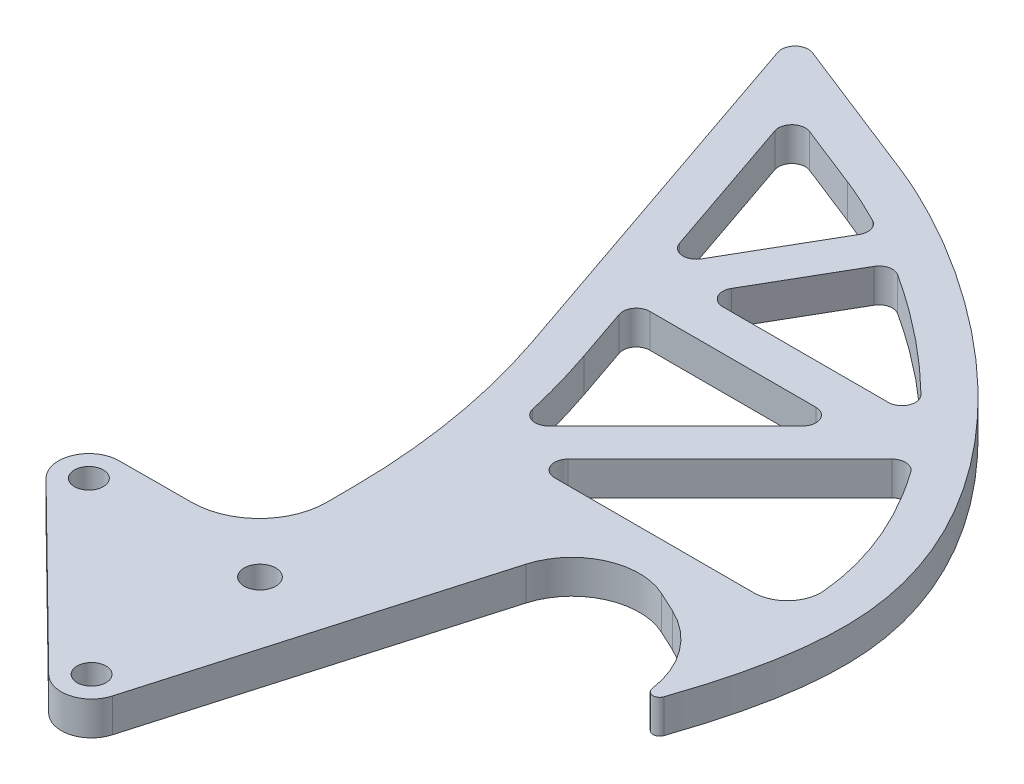
from build123d import *

# Parameters (mm, degrees)
SKETCH1_R           = 2.35
SKETCH1_R_2         = 2.15
BOSS_EXTRUDE1_DEPTH = 5
BOSS_EXTRUDE2_DEPTH = 5
FILLET9_START       = -1
FILLET9_DEPTH       = 7
FILLET10_R          = 10
FILLET11_R          = 10
FILLET12_R          = 2
FILLET13_R          = 100
CUT_EXTRUDE1_DEPTH  = 10
FILLET16_R          = 2
FILLET17_R          = 5


with BuildPart() as part:
    # Sketch1 → Boss-Extrude1 (new body)
    # profile 1 of 5: a face of its own
    with BuildSketch(Plane(origin=(0, 0, 0), x_dir=(1, 0, 0), z_dir=(0, 1, 0))):
        with BuildLine():
            Line((21.319657121, 32.633890732), (34.914273926, 26.294616806))
            ThreePointArc((34.914273926, 26.294616806), (41.225871687, 20.759494125), (43.575, 12.7))
            ThreePointArc((43.575, 12.7), (43.275555611, 9.717775204), (42.389178035, 6.854618472))
            add(Edge.make_bspline(
                [(42.389178035, 6.854618472), (44.342966782, 11.471936513), (48.441890724, 22.813367807), (54.26521217, 62.473053577), (15.464484864, 91.951031047), (-5, 100)],
                knots=[0, 0, 0, 0, 0.134757694, 0.296973126, 1, 1, 1, 1], degree=3))
            Line((-5, 100), (-4.618360102, 4.58315657))
            Line((-4.618360102, 4.58315657), (-4.499964006, -25.01799856))
            ThreePointArc((-4.499964006, -25.01799856), (-0.008999298, -20.500008999), (4.5, -25))
            ThreePointArc((4.5, -25), (4.455654175, -25.630195106), (4.323490724, -26.247969535))
            Line((4.323490724, -26.247969535), (14.266400512, 8.198446858))
            ThreePointArc((14.266400512, 8.198446858), (14.163364253, 16.859898449), (18.866215247, 24.134137424))
            Line((18.866215247, 24.134137424), (21.319657121, 32.633890732))
        make_face()
        with Locations(Location((0, 0, 0), (0, 0, 270))):
            Circle(SKETCH1_R, mode=Mode.SUBTRACT)
    # profile 2 of 5: a face of its own
    with BuildSketch(Plane(origin=(0, 0, 0), x_dir=(1, 0, 0), z_dir=(0, 1, 0))):
        with BuildLine():
            Line((14.266400512, 8.198446858), (18.866215247, 24.134137424))
            ThreePointArc((18.866215247, 24.134137424), (14.163364253, 16.859898449), (14.266400512, 8.198446858))
        make_face()
    # profile 3 of 5: a face of its own
    with BuildSketch(Plane(origin=(0, 0, 0), x_dir=(1, 0, 0), z_dir=(0, 1, 0))):
        with BuildLine():
            ThreePointArc((-3.156627288, -28.207133325), (1.140163698, -29.353162843), (4.323490724, -26.247969535))
            ThreePointArc((4.323490724, -26.247969535), (4.455654175, -25.630195106), (4.5, -25))
            ThreePointArc((4.5, -25), (-0.008999298, -20.500008999), (-4.499964006, -25.01799856))
            ThreePointArc((-4.499964006, -25.01799856), (-4.147106545, -26.746856406), (-3.156627288, -28.207133325))
        make_face()
        with Locations(Location((0, -25, 0), (0, 0, 270))):
            Circle(SKETCH1_R_2, mode=Mode.SUBTRACT)
    # profile 4 of 5: a face of its own
    with BuildSketch(Plane(origin=(0, 0, 0), x_dir=(1, 0, 0), z_dir=(0, 1, 0))):
        with BuildLine():
            Line((-4.499964006, -25.01799856), (-4.618360102, 4.58315657))
            Line((-4.618360102, 4.58315657), (-25.41799856, 4.499964006))
            ThreePointArc((-25.41799856, 4.499964006), (-22.224389312, 3.188337617), (-20.9, 0))
            ThreePointArc((-20.9, 0), (-23.661440653, -4.150591693), (-28.556627288, -3.207133325))
            Line((-28.556627288, -3.207133325), (-3.156627288, -28.207133325))
            ThreePointArc((-3.156627288, -28.207133325), (-4.147106545, -26.746856406), (-4.499964006, -25.01799856))
        make_face()
    # profile 5 of 5: a face of its own
    with BuildSketch(Plane(origin=(0, 0, 0), x_dir=(1, 0, 0), z_dir=(0, 1, 0))):
        with BuildLine():
            ThreePointArc((-20.9, 0), (-22.224389312, 3.188337617), (-25.41799856, 4.499964006))
            ThreePointArc((-25.41799856, 4.499964006), (-29.567661171, 1.69723315), (-28.556627288, -3.207133325))
            ThreePointArc((-28.556627288, -3.207133325), (-23.661440653, -4.150591693), (-20.9, 0))
        make_face()
        with Locations(Location((-25.4, 0, 0), (0, 0, 270))):
            Circle(SKETCH1_R_2, mode=Mode.SUBTRACT)
    extrude(amount=BOSS_EXTRUDE1_DEPTH)

    # Sketch2 → Boss-Extrude2 (add, through all)
    with BuildSketch(Plane(origin=(0, 5, 0), x_dir=(1, 0, 0), z_dir=(0, 1, 0))):
        Polygon((-5, 100), (-30.440224277, 110.005997059), (-4.740018717, 35), align=None)
    extrude(amount=-BOSS_EXTRUDE2_DEPTH)

    # Fillet9: read off the stored shape, not the designer's step
    # Fillet9 outline → Fillet9 (cut)
    with BuildSketch(Plane(origin=(0, 0, 0), x_dir=(1, 0, 0), z_dir=(0, 1, 0)).offset(FILLET9_START)):
        with BuildLine():
            add(Edge.make_bspline(
                [(42.389178035, 6.854618472), (43.427373548, 9.308148252), (44.439078816, 11.911072083), (45.365164545, 14.597488782)],
                knots=[0, 0, 0, 0, 0.07160694, 0.07160694, 0.07160694, 0.07160694], degree=3))
            ThreePointArc((45.365164545, 14.597488782), (44.323632558, 13.928027401), (43.429465164, 14.784433901))
            ThreePointArc((43.429465164, 14.784433901), (43.447567664, 10.748915407), (42.389178035, 6.854618472))
        make_face()
    extrude(amount=FILLET9_DEPTH, mode=Mode.SUBTRACT)

    # Fillet10
    fillet10_edges = [part.edges().sort_by_distance(p)[0] for p in [
        (21.319657121, 2.5, -32.633890732),
    ]]
    fillet(fillet10_edges, radius=FILLET10_R)

    # Fillet11
    fillet11_edges = [part.edges().sort_by_distance(p)[0] for p in [
        (-4.618360102, 2.5, -4.58315657),
    ]]
    fillet(fillet11_edges, radius=FILLET11_R)

    # Fillet12
    fillet12_edges = [part.edges().sort_by_distance(p)[0] for p in [
        (-30.440224277, 2.5, -110.005997059),
    ]]
    fillet(fillet12_edges, radius=FILLET12_R)

    # Fillet13
    fillet13_edges = [part.edges().sort_by_distance(p)[0] for p in [
        (-4.740018717, 2.5, -35),
    ]]
    fillet(fillet13_edges, radius=FILLET13_R)

    # Sketch3 → Cut-Extrude1 (cut)
    with BuildSketch(Plane(origin=(0, 5, 0), x_dir=(1, 0, 0), z_dir=(0, 1, 0))):
        with BuildLine():
            Line((-7.196124056, 94.416359688), (-20.556666638, 99.671248494))
            Line((-20.556666638, 99.671248494), (-10.34167973, 69.858830216))
            Line((-10.34167973, 69.858830216), (1.479992408, 90.33456699))
            add(Edge.make_bspline(
                [(1.479992408, 90.33456699), (1.28397872, 90.440564461), (0.569604437, 90.823664357), (-0.911069003, 91.59331249), (-2.926185163, 92.579659505), (-4.750200244, 93.404717974), (-6.168292078, 94.005080785), (-6.85002115, 94.280232561), (-7.196124056, 94.416359688)],
                knots=[0.899537877, 0.899537877, 0.899537877, 0.899537877, 0.905955438, 0.922989268, 0.948659512, 0.974329756, 0.987164878, 1, 1, 1, 1], degree=3))
        make_face()
        with BuildLine():
            add(Edge.make_bspline(
                [(28.891913577, 69.093470772), (28.667354165, 69.339735814), (26.185201557, 72.030266697), (22.009276054, 76.029258723), (16.240637184, 80.752486943), (11.640954059, 84.113026779), (8.44218135, 86.220773941), (6.886134042, 87.191294266), (6.670477462, 87.324750819)],
                knots=[0.599769047, 0.599769047, 0.599769047, 0.599769047, 0.608173487, 0.691957071, 0.743297559, 0.794638047, 0.837083391, 0.84392152, 0.84392152, 0.84392152, 0.84392152], degree=3))
            Line((6.670477462, 87.324750819), (-3.855356981, 69.093470772))
            Line((-3.855356981, 69.093470772), (28.891913577, 69.093470772))
        make_face()
        with BuildLine():
            Line((24.256703875, 63.093470772), (-8.023583375, 63.093470772))
            Line((-8.023583375, 63.093470772), (-4.396532038, 52.507928907))
            ThreePointArc((-4.396532038, 52.507928907), (-2.247165573, 45.44102658), (-0.595170682, 38.241596216))
            Line((-0.595170682, 38.241596216), (24.256703875, 63.093470772))
        make_face()
        with BuildLine():
            add(Edge.make_bspline(
                [(43.683908276, 34.631385763), (43.696866831, 34.851470147), (43.767861036, 36.240626578), (43.768636498, 39.331228462), (43.211809078, 43.755898325), (41.817266975, 48.782881707), (39.714268813, 53.778597693), (37.032666408, 58.583202787), (34.774401672, 61.875598877), (33.528556835, 63.529710734), (33.377122853, 63.728608376)],
                knots=[0.24062608, 0.24062608, 0.24062608, 0.24062608, 0.247043641, 0.281233166, 0.332573654, 0.383914142, 0.43525463, 0.486595118, 0.533806823, 0.540275717, 0.540275717, 0.540275717, 0.540275717], degree=3))
            Line((33.377122853, 63.728608376), (4.279900241, 34.631385764))
            Line((4.279900241, 34.631385764), (27.686110097, 34.631385764))
            Line((27.686110097, 34.631385764), (43.683908276, 34.631385763))
        make_face()
    extrude(amount=-CUT_EXTRUDE1_DEPTH, mode=Mode.SUBTRACT)

    # Fillet16
    fillet16_edges = [part.edges().sort_by_distance(p)[0] for p in [
        (33.377122853, 2.5, -63.728608376),
        (-20.556666638, 2.5, -99.671248494),
        (-10.34167973, 2.5, -69.858830216),
        (1.479992408, 2.5, -90.33456699),
        (6.670477462, 2.5, -87.324750819),
        (-3.855356981, 2.5, -69.093470772),
        (28.891913577, 2.5, -69.093470772),
        (-8.023583375, 2.5, -63.093470772),
        (-0.595170682, 2.5, -38.241596216),
        (24.256703875, 2.5, -63.093470772),
        (4.279900241, 2.5, -34.631385764),
    ]]
    fillet(fillet16_edges, radius=FILLET16_R)

    # Fillet17
    fillet17_edges = [part.edges().sort_by_distance(p)[0] for p in [
        (43.683908276, 2.5, -34.631385763),
    ]]
    fillet(fillet17_edges, radius=FILLET17_R)


solid = part.part
